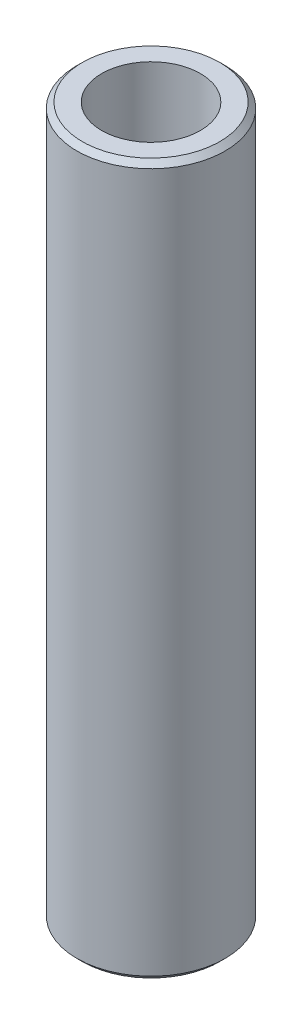
from build123d import *

# Parameters (mm, degrees)
SKETCH1_R           = 40
BOSS_EXTRUDE1_DEPTH = 383.320295648
SKETCH2_R           = 26.656632809
CUT_EXTRUDE1_DEPTH  = 388.471868728
CHAMFER1_SIZE       = 2.917234449


with BuildPart() as part:
    # Sketch1 → Boss-Extrude1 (new body)
    with BuildSketch(Plane(origin=(0, 0, 0), x_dir=(1, 0, 0), z_dir=(0, 1, 0))):
        Circle(SKETCH1_R)
    extrude(amount=BOSS_EXTRUDE1_DEPTH)

    # Sketch2 → Cut-Extrude1 (cut, through all)
    with BuildSketch(Plane(origin=(0, 0, 0), x_dir=(1, 0, 0), z_dir=(0, 1, 0))):
        Circle(SKETCH2_R)
    extrude(amount=CUT_EXTRUDE1_DEPTH, mode=Mode.SUBTRACT)

    # Chamfer1
    chamfer1_edges = [part.edges().sort_by_distance(p)[0] for p in [
        (-40, 383.320295648, 0),
        (-40, 0, 0),
    ]]
    chamfer(chamfer1_edges, length=CHAMFER1_SIZE)


solid = part.part
